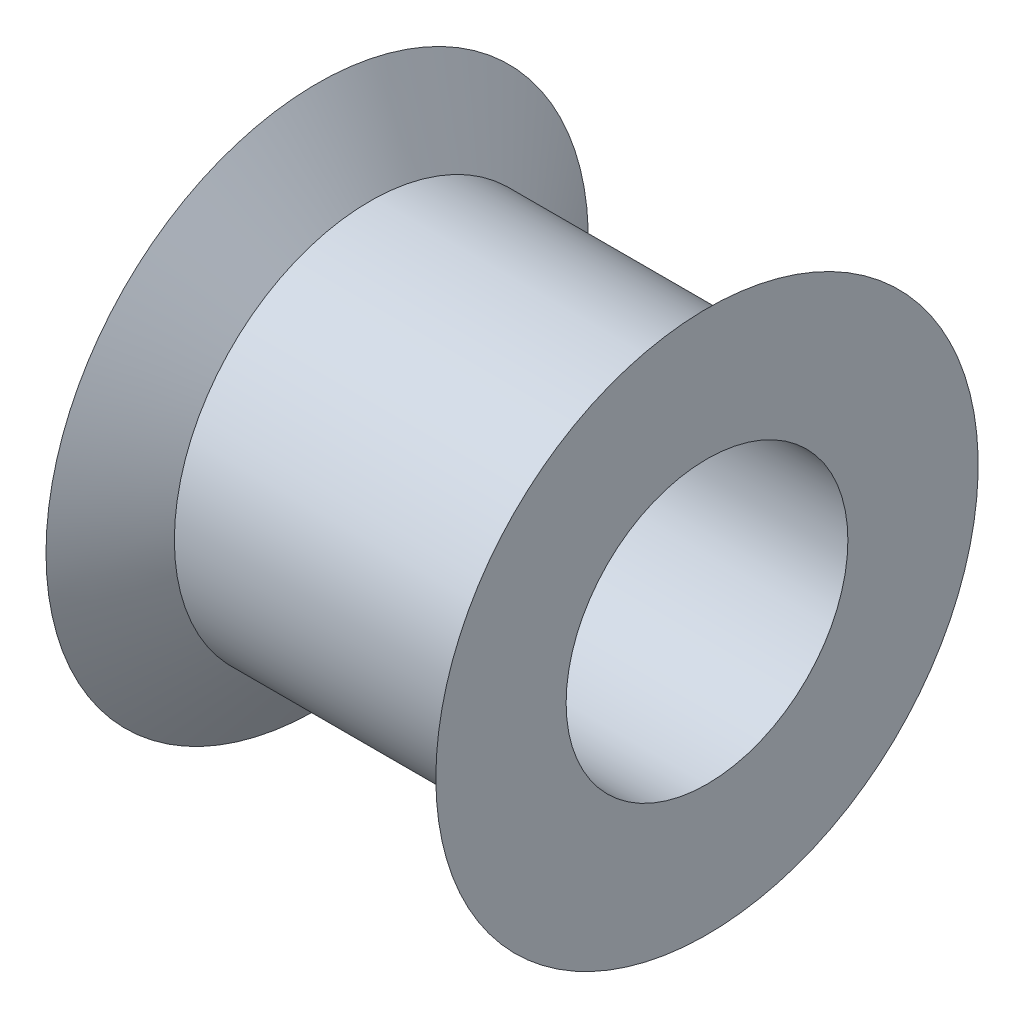
from build123d import *


with BuildPart() as part:
    # Sketch2 → Revolve1 (revolve)
    with BuildSketch(Plane.XY):
        Polygon((0, 2.286), (6.3256, 2.286), (6.3256, 4.4), (5.467845766, 3.175), (0.857754234, 3.175), (0, 4.4), align=None)
    revolve(axis=Axis((0, 0, 0), (1, 0, 0)))


solid = part.part
